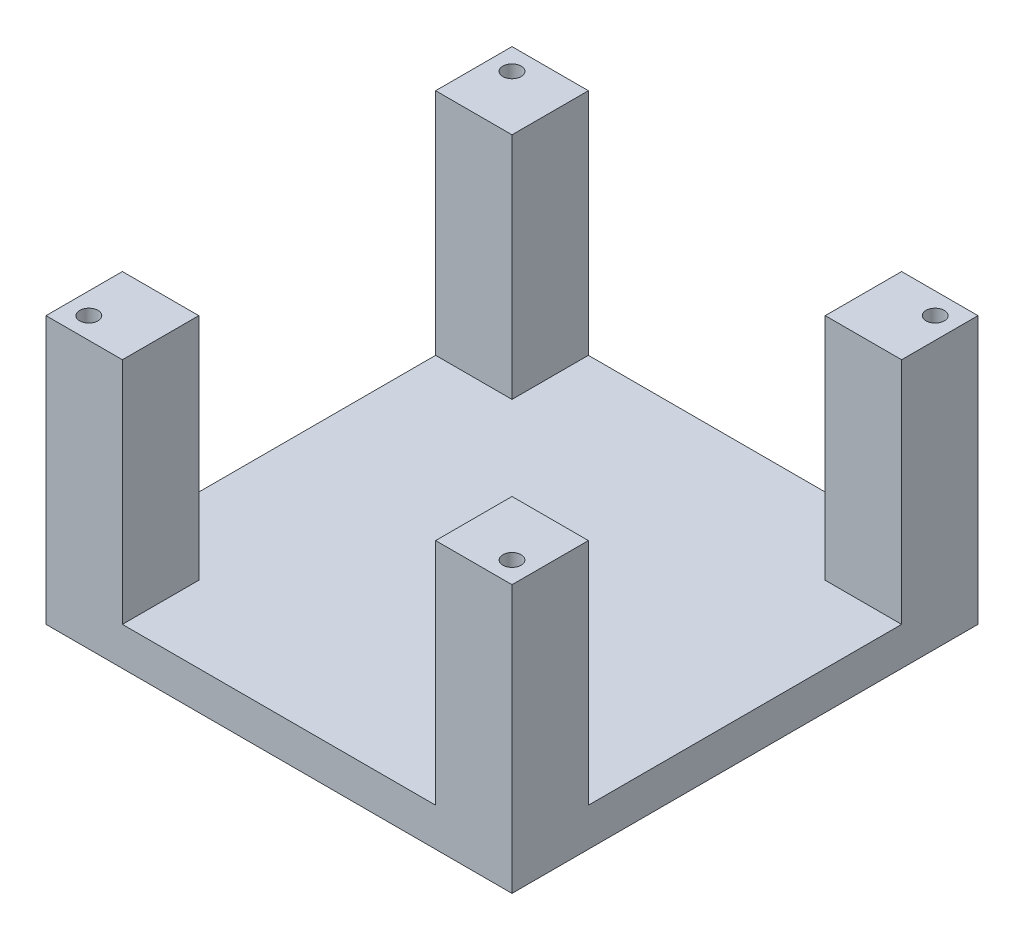
from build123d import *

# Parameters (mm, degrees)
SKETCH3_W           = 154.94
SKETCH3_H           = 154.94
BOSS_EXTRUDE3_DEPTH = 6.35
SKETCH4_W           = 25.4
SKETCH4_H           = 25.4
BOSS_EXTRUDE4_DEPTH = 76.2
SKETCH5_R           = 3.04
CUT_EXTRUDE1_DEPTH  = 19.05


with BuildPart() as part:
    # Sketch3 → Boss-Extrude3 (new, symmetric)
    with BuildSketch(Plane(origin=(0, 0, 0), x_dir=(1, 0, 0), z_dir=(0, 1, 0))):
        Rectangle(SKETCH3_W, SKETCH3_H)
    extrude(amount=BOSS_EXTRUDE3_DEPTH, both=True)

    # Sketch4 → Boss-Extrude4 (add)
    with BuildSketch(Plane(origin=(0, 6.35, 0), x_dir=(1, 0, 0), z_dir=(0, 1, 0))):
        with Locations((-64.77, 64.77)):
            Rectangle(SKETCH4_W, SKETCH4_H)
        with Locations((64.77, 64.77)):
            Rectangle(SKETCH4_W, SKETCH4_H)
        with Locations((64.77, -64.77)):
            Rectangle(SKETCH4_W, SKETCH4_H)
        with Locations((-64.77, -64.77)):
            Rectangle(SKETCH4_W, SKETCH4_H)
    extrude(amount=BOSS_EXTRUDE4_DEPTH)

    # Sketch5 → Cut-Extrude1 (cut)
    with BuildSketch(Plane(origin=(0, 82.55, 0), x_dir=(1, 0, 0), z_dir=(0, 1, 0))):
        with Locations((70.35005366, 70.35005366)):
            Circle(SKETCH5_R)
        with Locations((-70.35005366, 70.35005366)):
            Circle(SKETCH5_R)
        with Locations((-70.35005366, -70.35005366)):
            Circle(SKETCH5_R)
        with Locations((70.35005366, -70.35005366)):
            Circle(SKETCH5_R)
    extrude(amount=-CUT_EXTRUDE1_DEPTH, mode=Mode.SUBTRACT)


solid = part.part
